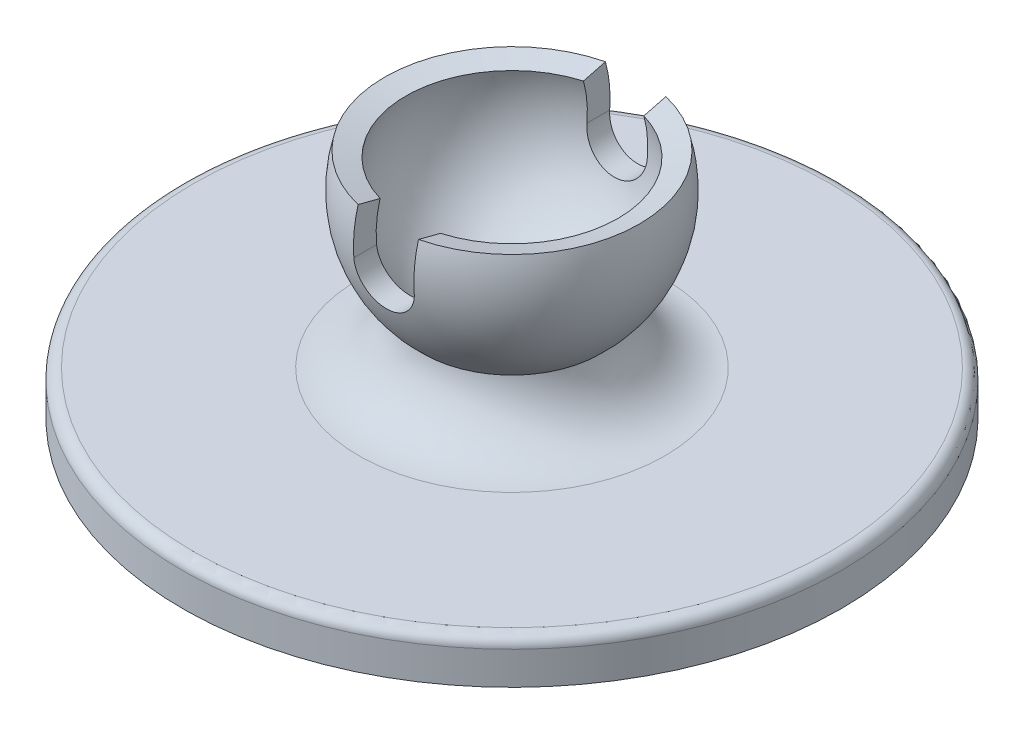
from build123d import *

# Parameters (mm, degrees)
SKETCH3_R               = 15
BOSS_EXTRUDE1_DEPTH     = 2
CUT_EXTRUDE1_DEPTH      = 23.872523746
CUT_EXTRUDE1_DEPTH_BACK = 23.872523746
FILLET1_R               = 3
FILLET2_R               = 0.5


with BuildPart() as part:
    # Sketch2 → Revolve2 (revolve)
    with BuildSketch(Plane.XY):
        with BuildLine():
            Line((0, 0), (4, 0))
            Line((4, 0), (4, 2.527864045))
            ThreePointArc((4, 2.527864045), (5.75008972, 5.28638738), (5.795554958, 8.552914271))
            Line((5.795554958, 8.552914271), (4.829629131, 8.294095226))
            ThreePointArc((4.829629131, 8.294095226), (3.966766701, 3.956192855), (0, 2))
            Line((0, 2), (0, 0))
        make_face()
    revolve(axis=Axis((0, 2, 0), (0, -1, 0)))

    # Sketch3 → Boss-Extrude1 (add)
    with BuildSketch(Plane.XZ):
        Circle(SKETCH3_R)
    extrude(amount=BOSS_EXTRUDE1_DEPTH)

    # Sketch6 → Cut-Extrude1 (cut, two sides: drawn at the far end of the back side and taken through both)
    with BuildSketch(Plane.XY.offset(-CUT_EXTRUDE1_DEPTH_BACK)):
        with BuildLine():
            Line((1.375, 6.552914271), (1.375, 8.552914271))
            Line((1.375, 8.552914271), (-1.375, 8.552914271))
            Line((-1.375, 8.552914271), (-1.375, 6.552914271))
            ThreePointArc((-1.375, 6.552914271), (0, 5.177914271), (1.375, 6.552914271))
        make_face()
    extrude(amount=CUT_EXTRUDE1_DEPTH + CUT_EXTRUDE1_DEPTH_BACK, mode=Mode.SUBTRACT)

    # Fillet1
    # the kernel refuses this fillet: 3 mm, written as the material it adds along each edge
    with BuildSketch(Plane(origin=(0, 0, 0), x_dir=(1, 0, 0), z_dir=(0, 0, -1))) as fillet1_piece_1:
        with BuildLine():
            CenterArc((6.962615, -3), FILLET1_R, 90, 80.945223599)
            Line((4, -2.527864045), (3.9407477, -2.518421326))
            ThreePointArc((3.9407477, -2.518421326), (3.94, -1.263932023), (3.94, 0))
            Line((3.94, 0), (4, 0.06))
            Line((4, 0.06), (6.962615, 0.06))
            Line((6.962615, 0.06), (6.962615, 0))
        make_face()
    revolve(axis=Axis((0, 0, 0), (0, -1, 0)))

    # Fillet2
    fillet2_edges = [part.edges().sort_by_distance(p)[0] for p in [
        (-15, 0, 0),
    ]]
    fillet(fillet2_edges, radius=FILLET2_R)


solid = part.part
